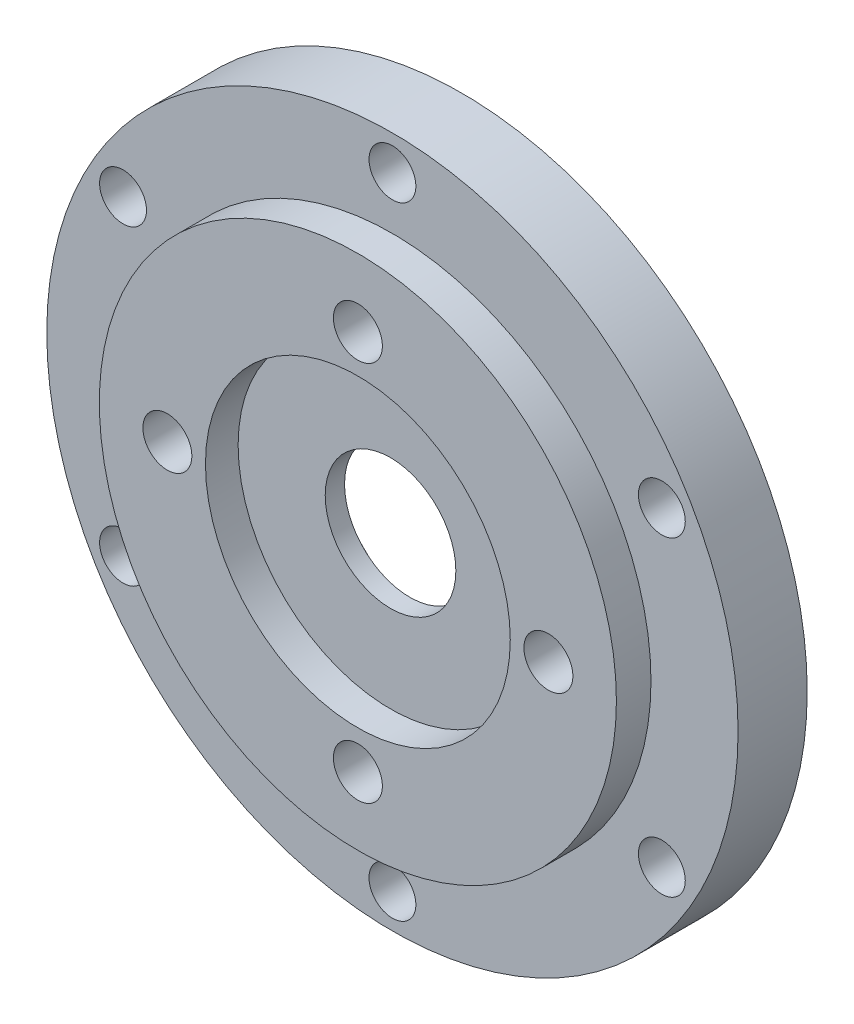
from build123d import *

# Parameters (mm, degrees)
SKETCH1_R                      = 31.75
BOSS_EXTRUDE1_DEPTH            = 9.525
SKETCH2_R                      = 14
CUT_EXTRUDE1_DEPTH             = 3
F_8_CLEARANCE_HOLE1_D          = 4.3053
SKETCH5_R                      = 12.7
CUT_EXTRUDE2_DEPTH             = 4.7498
SKETCH6_R                      = 6
CUT_EXTRUDE3_DEPTH             = 46.154485215
CBORE_FOR_M4_SHCS1_D           = 4.5
CBORE_FOR_M4_SHCS1_CBORE_D     = 8
CBORE_FOR_M4_SHCS1_CBORE_DEPTH = 4
SKETCH9_OUTSIDE_W              = 83.562
SKETCH9_OUTSIDE_H              = 83.562
SKETCH9_OUTSIDE_R              = 23.749
CUT_EXTRUDE4_DEPTH             = 3.175


with BuildPart() as part:
    # Sketch1 → Boss-Extrude1 (new body)
    with BuildSketch(Plane.XY):
        Circle(SKETCH1_R)
    extrude(amount=BOSS_EXTRUDE1_DEPTH)

    # Sketch2 → Cut-Extrude1 (cut)
    with BuildSketch(Plane.XY.offset(9.525)):
        Circle(SKETCH2_R)
    extrude(amount=-CUT_EXTRUDE1_DEPTH, mode=Mode.SUBTRACT)

    # #8 Clearance Hole1 (through all)
    with Locations(Plane.XY.offset(9.525)):
        with Locations((0, 28.575), (24.746675913, 14.2875), (24.746675913, -14.2875), (0, -28.575), (-24.746675913, -14.2875), (-24.746675913, 14.2875)):
            Hole(F_8_CLEARANCE_HOLE1_D / 2)

    # Sketch5 → Cut-Extrude2 (cut)
    with BuildSketch(Plane(origin=(0, 0, 0), x_dir=(-1, 0, 0), z_dir=(0, 0, -1))):
        Circle(SKETCH5_R)
    extrude(amount=-CUT_EXTRUDE2_DEPTH, mode=Mode.SUBTRACT)

    # Sketch6 → Cut-Extrude3 (cut, through all)
    with BuildSketch(Plane(origin=(0, 0, 4.7498), x_dir=(-1, 0, 0), z_dir=(0, 0, -1))):
        Circle(SKETCH6_R)
    extrude(amount=-CUT_EXTRUDE3_DEPTH, mode=Mode.SUBTRACT)

    # CBORE for M4 SHCS1 (through all)
    with Locations(Plane(origin=(0, 0, 0), x_dir=(-1, 0, 0), z_dir=(0, 0, -1))):
        with Locations((0, 17.5), (17.5, 0), (0, -17.5), (-17.5, 0)):
            CounterBoreHole(CBORE_FOR_M4_SHCS1_D / 2, CBORE_FOR_M4_SHCS1_CBORE_D / 2, CBORE_FOR_M4_SHCS1_CBORE_DEPTH)

    # Sketch9 outside → Cut-Extrude4 (cut)
    with BuildSketch(Plane.XY.offset(9.525)):
        Rectangle(SKETCH9_OUTSIDE_W, SKETCH9_OUTSIDE_H)
        Circle(SKETCH9_OUTSIDE_R, mode=Mode.SUBTRACT)
    extrude(amount=-CUT_EXTRUDE4_DEPTH, mode=Mode.SUBTRACT)


solid = part.part
